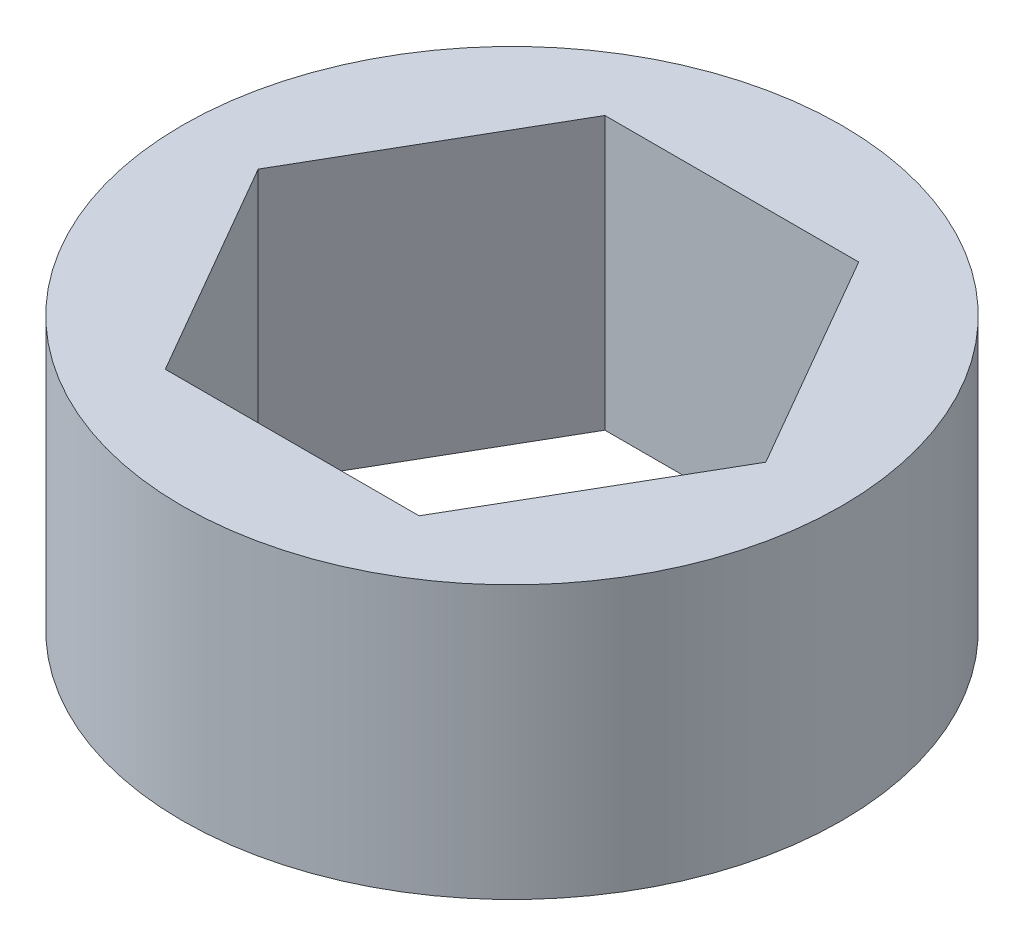
from build123d import *

# Parameters (mm, degrees)
SKETCH1_R           = 9.525
BOSS_EXTRUDE1_DEPTH = 7.874


with BuildPart() as part:
    # Sketch1 → Boss-Extrude1 (new body)
    with BuildSketch(Plane(origin=(0, 0, 0), x_dir=(1, 0, 0), z_dir=(0, 1, 0))):
        Circle(SKETCH1_R)
        Polygon((3.666174209, 6.35), (-3.666174209, 6.35), (-7.332348419, 0), (-3.666174209, -6.35), (3.666174209, -6.35), (7.332348419, 0), align=None, mode=Mode.SUBTRACT)
    extrude(amount=BOSS_EXTRUDE1_DEPTH)


solid = part.part
